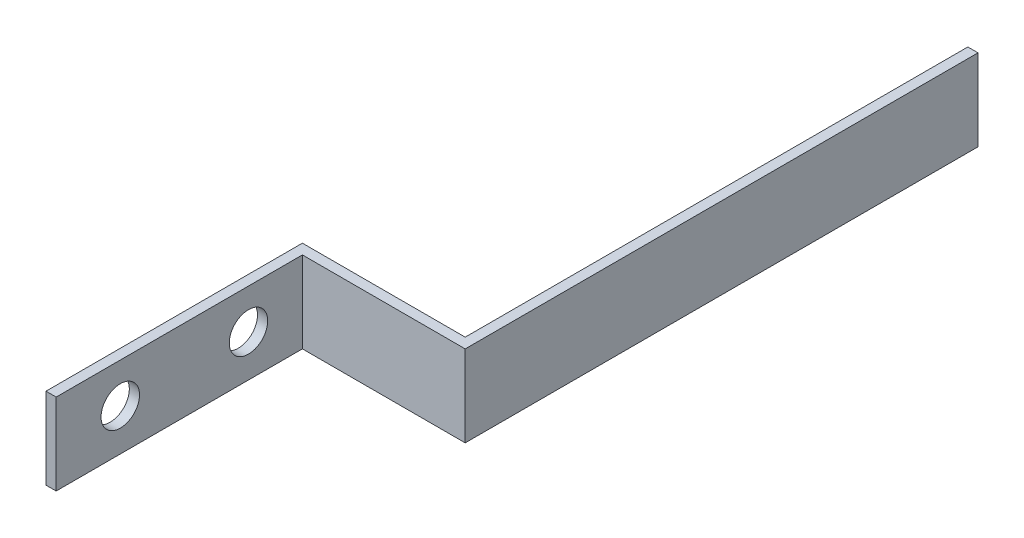
from build123d import *

# Parameters (mm, degrees)
BOSS_EXTRUDE1_DEPTH = 25.4
SKETCH2_R           = 6
CUT_EXTRUDE1_DEPTH  = 25.4


with BuildPart() as part:
    # Sketch1 → Boss-Extrude1 (new body)
    with BuildSketch(Plane(origin=(0, 0, 0), x_dir=(1, 0, 0), z_dir=(0, 1, 0))):
        Polygon((0, 0), (0, 80), (50.8, 80), (50.8, 236.825), (53.975, 236.825), (53.975, 76.825), (3.175, 76.825), (3.175, 0), align=None)
    extrude(amount=BOSS_EXTRUDE1_DEPTH)

    # Sketch2 → Cut-Extrude1 (cut)
    with BuildSketch(Plane(origin=(3.175, 0, 0), x_dir=(0, 0, -1), z_dir=(1, 0, 0))):
        with Locations((60, 13)):
            Circle(SKETCH2_R)
        with Locations((20, 13)):
            Circle(SKETCH2_R)
    extrude(amount=-CUT_EXTRUDE1_DEPTH, mode=Mode.SUBTRACT)


solid = part.part
